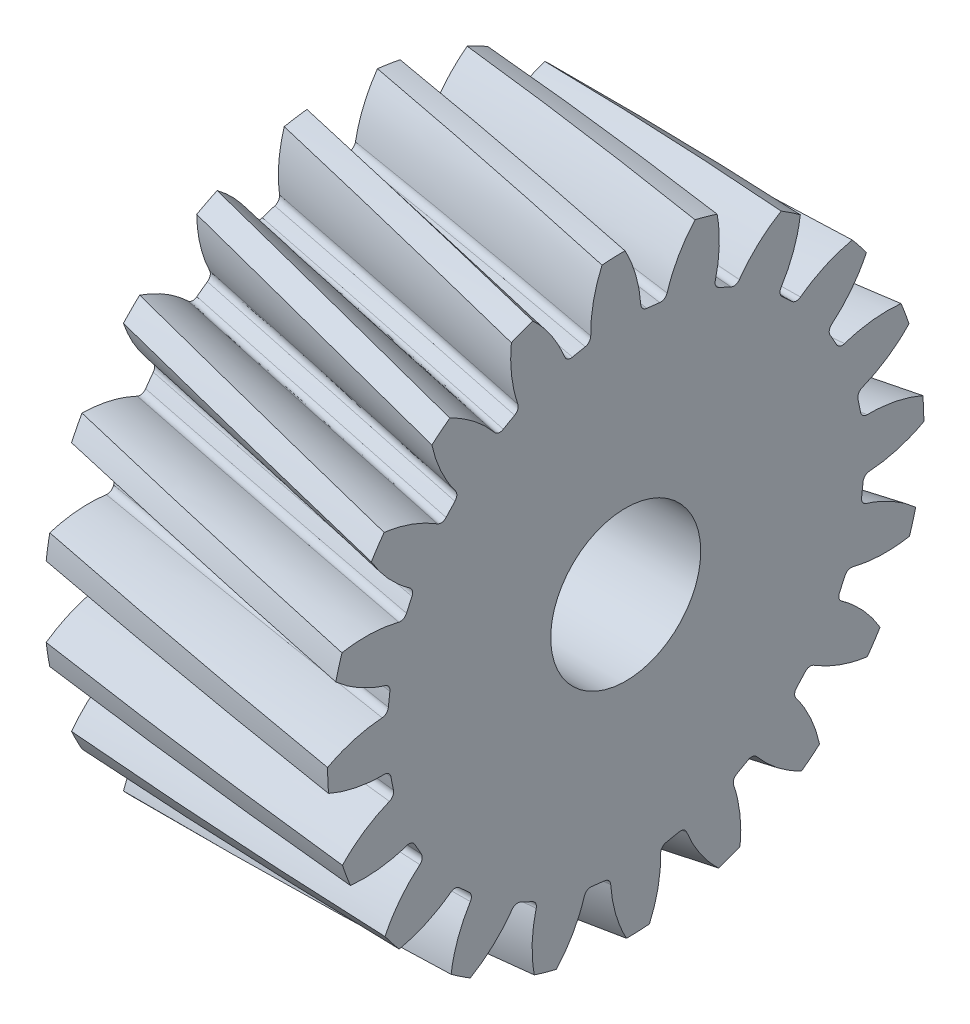
from build123d import *

# Parameters (mm, degrees)
BASPROSKE_W            = 12
BASPROSKE_H            = 12.616577218
TOOTHCUTRH_PITCH       = 380.483355173
TOOTHCUTRH_HEIGHT      = 12
TOOTHCUTRH_RADIUS      = 12.616577218
TOOTHCUTRH_START_ANGLE = -90
TEETHCUTSRH_COUNT      = 20
TEETHCUTSRH_ANGLE      = 342
BORSKE_R               = 3
BORE_DEPTH             = 62.5000025
SKETCH3_R              = 3.175
CUT_EXTRUDE1_DEPTH     = 22.502466111


with BuildPart() as part:
    # BasProSke → Base-Revolve (revolve)
    with BuildSketch(Plane(origin=(0, 0, 0), x_dir=(1, 0, 0), z_dir=(0, 1, 0)), mode=Mode.PRIVATE) as base_revolve_sk:
        with Locations((6, 6.308288609)):
            Rectangle(BASPROSKE_W, BASPROSKE_H)
    revolve(base_revolve_sk.sketch.rotate(Axis((-10, 0, 0), (1, 0, 0)), 180), axis=Axis((-10, 0, 0), (1, 0, 0)))

    # ToothCutRH: sweep along a helix
    with BuildLine() as toothcutrh_path:
        add(Helix(TOOTHCUTRH_PITCH, TOOTHCUTRH_HEIGHT, TOOTHCUTRH_RADIUS, center=(0, 0, 0), direction=(1, 0, 0), mode=Mode.PRIVATE).rotate(Axis((0, 0, 0), (1, 0, 0)), TOOTHCUTRH_START_ANGLE))
    # TooCutSkeRH → ToothCutRH (sweep, cut)
    with BuildSketch(Plane(origin=(0, 0, 0), x_dir=(0, 0, -1), z_dir=(1, 0, 0))):
        with BuildLine():
            ThreePointArc((0.275549447, 10.081562259), (0, 10.085327218), (-0.275549447, 10.081562259))
            ThreePointArc((-0.275549447, 10.081562259), (-0.460835665, 10.14431612), (-0.560819634, 10.312459617))
            ThreePointArc((-0.560819634, 10.312459617), (-0.99534644, 11.670524164), (-1.757393162, 12.875695376))
            ThreePointArc((-1.757393162, 12.875695376), (0, 12.995074534), (1.757393162, 12.875695376))
            ThreePointArc((1.757393162, 12.875695376), (0.99534644, 11.670524164), (0.560819634, 10.312459617))
            ThreePointArc((0.560819634, 10.312459617), (0.460835665, 10.14431612), (0.275549447, 10.081562259))
        make_face()
    toothcutrh = sweep(path=toothcutrh_path.line, is_frenet=True, mode=Mode.SUBTRACT)

    # TeethCutsRH: ToothCutRH ×20 about axis
    teethcutsrh_axis = Axis((-10, 0, 0), (1, 0, 0))
    for i in range(1, TEETHCUTSRH_COUNT):
        add(toothcutrh.rotate(teethcutsrh_axis, i * TEETHCUTSRH_ANGLE / (TEETHCUTSRH_COUNT - 1)), mode=Mode.SUBTRACT)

    # BorSke → Bore (cut, symmetric)
    with BuildSketch(Plane(origin=(0, 0, 0), x_dir=(0, 0, -1), z_dir=(1, 0, 0))):
        with Locations(Location((0, 0, 0), (0, 0, 180))):
            Circle(BORSKE_R)
    extrude(amount=BORE_DEPTH, both=True, mode=Mode.SUBTRACT)

    # Sketch3 → Cut-Extrude1 (cut, through all)
    with BuildSketch(Plane(origin=(12, 0, 0), x_dir=(0, 0, -1), z_dir=(1, 0, 0))):
        Circle(SKETCH3_R)
    extrude(amount=-CUT_EXTRUDE1_DEPTH, mode=Mode.SUBTRACT)


solid = part.part
